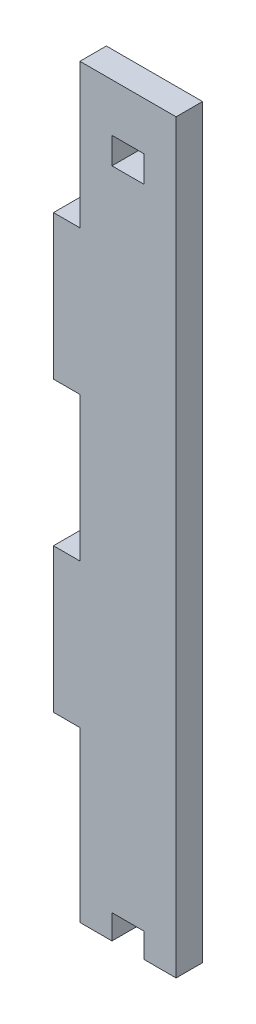
from build123d import *

# Parameters (mm, degrees)
BOSS_EXTRUDE1_DEPTH = 5.5
CAVITY1_START       = 134.5
CAVITY1_OUTLINE_W   = 6.666666666
CAVITY1_OUTLINE_H   = 5.5
CAVITY1_DEPTH       = 5.5
SKETCH2_W           = 6.666666667
SKETCH2_H           = 5.1
BOSS_EXTRUDE2_DEPTH = 5.5


# Read off the part's stored shape, not the designer's step: Cavity1
with BuildPart() as part:
    # Sketch1 → Boss-Extrude1 (new body)
    with BuildSketch(Plane.XY):
        Polygon((0, 120), (0, 150), (20, 150), (20, 0), (0, 0), (0, 30), (-5.5, 30), (-5.5, 60), (0, 60), (0, 90), (-5.5, 90), (-5.5, 120), align=None)
    extrude(amount=BOSS_EXTRUDE1_DEPTH)

    # Cavity1 outline → Cavity1 (cut)
    with BuildSketch(Plane(origin=(0, 0, 0), x_dir=(1, 0, 0), z_dir=(0, 1, 0)).offset(CAVITY1_START)):
        with Locations((10, -2.75)):
            Rectangle(CAVITY1_OUTLINE_W, CAVITY1_OUTLINE_H)
    extrude(amount=CAVITY1_DEPTH, mode=Mode.SUBTRACT)

    # Sketch2 → Boss-Extrude2 (add)
    with BuildSketch(Plane.XY.offset(5.5)):
        with Locations((3.333333334, -2.55)):
            Rectangle(SKETCH2_W, SKETCH2_H)
        with Locations((16.666666666, -2.55)):
            Rectangle(SKETCH2_W, SKETCH2_H)
    extrude(amount=-BOSS_EXTRUDE2_DEPTH)


solid = part.part
